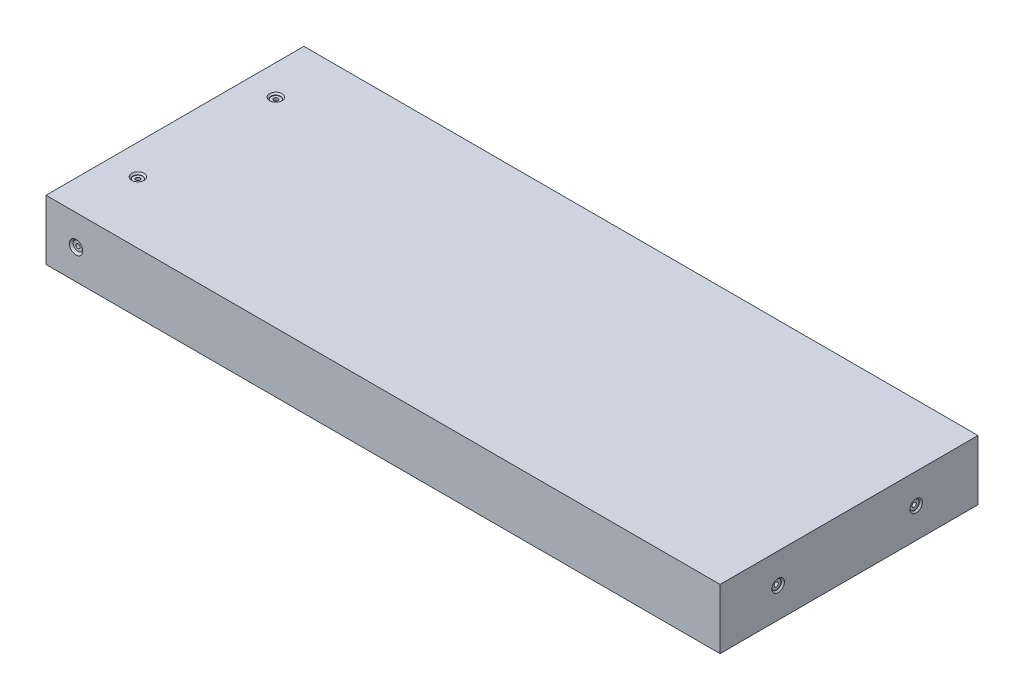
from build123d import *

# Parameters (mm, degrees)
SKETCH1_W                                   = 285.4
SKETCH1_H                                   = 109.2
BOSS_EXTRUDE1_DEPTH                         = 25.4
CBORE_FOR_0_BINDING_HEAD_MACHINE_SC_2_COUNT = 2
CBORE_FOR_0_BINDING_HEAD_MACHINE_SC_2_PITCH = 58.4
CBORE_FOR_0_BINDING_HEAD_MACHINE_SC_3_COUNT = 2
CBORE_FOR_0_BINDING_HEAD_MACHINE_SC_3_PITCH = 58.4


with BuildPart() as part:
    # Sketch1 → Boss-Extrude1 (new body)
    with BuildSketch(Plane(origin=(0, 0, 0), x_dir=(1, 0, 0), z_dir=(0, 1, 0))):
        Rectangle(SKETCH1_W, SKETCH1_H)
    extrude(amount=BOSS_EXTRUDE1_DEPTH)

    # Sketch3 → CBORE for #0 Binding Head Machine Screw1 (revolve, cut)
    with BuildSketch(Plane(origin=(-130, 12.7, 54.6), x_dir=(0, -1, 0), z_dir=(1, 0, 0))):
        Polygon((0, 0), (0, 30.53416509), (0.889, 30), (0.889, 0.8128), (1.98501, 0.8128), (1.98501, 0.87249), (2.8575, 0), align=None)
    cbore_for_0_binding_head_machine_screw1 = revolve(axis=Axis((-130, 12.7, 60.95), (0, 0, -1)), mode=Mode.SUBTRACT)

    # Mirror1: CBORE for #0 Binding Head Machine Screw1 across plane
    add(cbore_for_0_binding_head_machine_screw1.mirror(Plane.XY), mode=Mode.SUBTRACT)

    # Sketch5 → CBORE for #0 Binding Head Machine Screw2 (revolve, cut)
    with BuildSketch(Plane(origin=(142.7, 12.7, 30), x_dir=(0, 0, -1), z_dir=(0, 1, 0))):
        Polygon((0, 0), (0, 30.53416509), (0.889, 30), (0.889, 0.8128), (1.98501, 0.8128), (1.98501, 0.635), (2.62001, 0), align=None)
    cbore_for_0_binding_head_machine_screw2 = revolve(axis=Axis((149.05, 12.7, 30), (-1, 0, 0)), mode=Mode.SUBTRACT)

    # CBORE for _0 Binding Head Machine Sc 2: CBORE for #0 Binding Head Machine Screw2 ×2
    with Locations(*[(0, 0, -i * CBORE_FOR_0_BINDING_HEAD_MACHINE_SC_2_PITCH) for i in range(1, CBORE_FOR_0_BINDING_HEAD_MACHINE_SC_2_COUNT)]):
        add(cbore_for_0_binding_head_machine_screw2, mode=Mode.SUBTRACT)

    # Sketch7 → CBORE for #0 Binding Head Machine Screw3 (revolve, cut)
    with BuildSketch(Plane(origin=(-130, 25.4, -30), x_dir=(0, 0, 1), z_dir=(1, 0, 0))):
        Polygon((0, 0), (0, 30.53416509), (0.889, 30), (0.889, 0.8128), (1.98501, 0.8128), (1.98501, 0.635), (2.62001, 0), align=None)
    cbore_for_0_binding_head_machine_screw3 = revolve(axis=Axis((-130, 31.75, -30), (0, -1, 0)), mode=Mode.SUBTRACT)

    # CBORE for _0 Binding Head Machine Sc 3: CBORE for #0 Binding Head Machine Screw3 ×2
    with Locations(*[(0, 0, i * CBORE_FOR_0_BINDING_HEAD_MACHINE_SC_3_PITCH) for i in range(1, CBORE_FOR_0_BINDING_HEAD_MACHINE_SC_3_COUNT)]):
        add(cbore_for_0_binding_head_machine_screw3, mode=Mode.SUBTRACT)


solid = part.part
